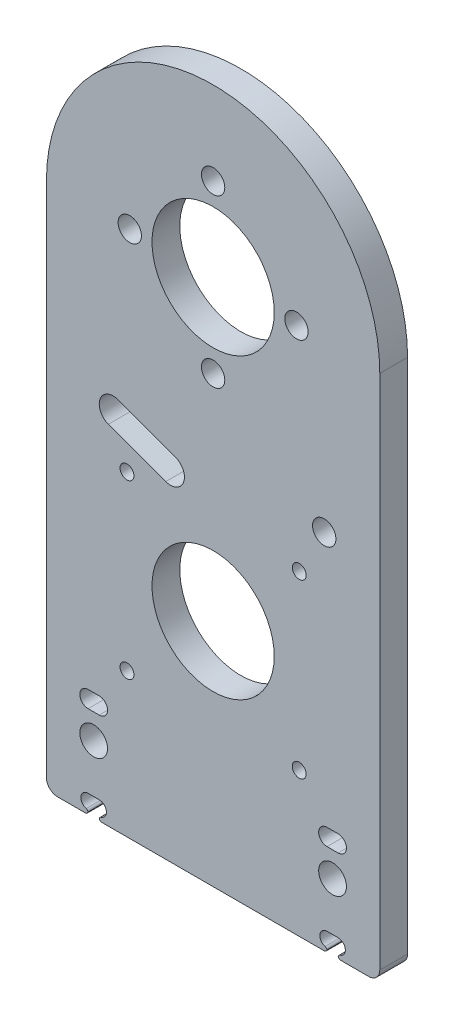
from build123d import *

# Parameters (mm, degrees)
SKETCH1_R           = 11
SKETCH1_R_2         = 1.25
SKETCH1_R_3         = 2.5
SKETCH1_R_4         = 2.1
BOSS_EXTRUDE1_DEPTH = 2.5
FILLET1_R           = 0.5
FILLET2_R           = 2


with BuildPart() as part:
    # Sketch1 → Boss-Extrude1 (new, symmetric)
    with BuildSketch(Plane.XY):
        with BuildLine():
            Line((-30, -46), (-22.5, -46))
            Line((-22.5, -46), (-22.5, -45.3))
            ThreePointArc((-22.5, -45.3), (-23.8, -44), (-22.5, -42.7))
            Line((-22.5, -42.7), (-20.5, -42.7))
            ThreePointArc((-20.5, -42.7), (-19.2, -44), (-20.5, -45.3))
            Line((-20.5, -45.3), (-20.5, -46))
            Line((-20.5, -46), (20.5, -46))
            Line((20.5, -46), (20.5, -45.3))
            ThreePointArc((20.5, -45.3), (19.2, -44), (20.5, -42.7))
            Line((20.5, -42.7), (22.5, -42.7))
            ThreePointArc((22.5, -42.7), (23.8, -44), (22.5, -45.3))
            Line((22.5, -45.3), (22.5, -46))
            Line((22.5, -46), (30, -46))
            Line((30, -46), (30, 49))
            ThreePointArc((30, 49), (0, 79), (-30, 49))
            Line((-30, 49), (-30, -46))
        make_face()
        with Locations((0, -4.6)):
            Circle(SKETCH1_R, mode=Mode.SUBTRACT)
        with Locations((15.5, 10.9)):
            Circle(SKETCH1_R_2, mode=Mode.SUBTRACT)
        with Locations((15.5, -20.1)):
            Circle(SKETCH1_R_2, mode=Mode.SUBTRACT)
        with Locations((-15.5, -20.1)):
            Circle(SKETCH1_R_2, mode=Mode.SUBTRACT)
        with Locations((-15.5, 10.9)):
            Circle(SKETCH1_R_2, mode=Mode.SUBTRACT)
        with Locations((0, 49)):
            Circle(SKETCH1_R, mode=Mode.SUBTRACT)
        with Locations((21.5, -34)):
            Circle(SKETCH1_R_3, mode=Mode.SUBTRACT)
        with Locations((-21.5, -34)):
            Circle(SKETCH1_R_3, mode=Mode.SUBTRACT)
        with Locations((0, 64)):
            Circle(SKETCH1_R_4, mode=Mode.SUBTRACT)
        with Locations((-15, 49)):
            Circle(SKETCH1_R_4, mode=Mode.SUBTRACT)
        with Locations((0, 34)):
            Circle(SKETCH1_R_4, mode=Mode.SUBTRACT)
        with Locations((15, 49)):
            Circle(SKETCH1_R_4, mode=Mode.SUBTRACT)
        with Locations((20, 19.25)):
            Circle(SKETCH1_R_4, mode=Mode.SUBTRACT)
        with BuildLine():
            Line((20.5, -26.5), (22.5, -26.5))
            ThreePointArc((22.5, -26.5), (24, -28), (22.5, -29.5))
            Line((22.5, -29.5), (20.5, -29.5))
            ThreePointArc((20.5, -29.5), (19, -28), (20.5, -26.5))
        make_face(mode=Mode.SUBTRACT)
        with BuildLine():
            Line((-20.5, -26.5), (-22.5, -26.5))
            ThreePointArc((-22.5, -26.5), (-24, -28), (-22.5, -29.5))
            Line((-22.5, -29.5), (-20.5, -29.5))
            ThreePointArc((-20.5, -29.5), (-19, -28), (-20.5, -26.5))
        make_face(mode=Mode.SUBTRACT)
        with BuildLine():
            Line((-8.51843153, 12.888546871), (-18.855050358, 16.650768448))
            ThreePointArc((-18.855050358, 16.650768448), (-20.349231552, 19.855050358), (-17.144949642, 21.349231552))
            Line((-17.144949642, 21.349231552), (-6.808330813, 17.587009975))
            ThreePointArc((-6.808330813, 17.587009975), (-5.314149619, 14.382728065), (-8.51843153, 12.888546871))
        make_face(mode=Mode.SUBTRACT)
    extrude(amount=BOSS_EXTRUDE1_DEPTH, both=True)

    # Fillet1
    # the kernel refuses this fillet: 0.5 mm, written as the material it takes off along each edge
    with BuildSketch(Plane(origin=(-22.5, -46, -3.75), x_dir=(0, 1, 0), z_dir=(0, 0, 1)), Plane(origin=(-20.5, -46, -3.75), x_dir=(1, 0, 0), z_dir=(0, 0, 1)), Plane(origin=(20.5, -46, -3.75), x_dir=(0, 1, 0), z_dir=(0, 0, 1)), Plane(origin=(22.5, -46, -3.75), x_dir=(1, 0, 0), z_dir=(0, 0, 1))) as fillet1_piece_1:
        with BuildLine():
            CenterArc((FILLET1_R, FILLET1_R), FILLET1_R, 180, 90)
            Line((0, FILLET1_R), (0, 0))
            Line((0, 0), (FILLET1_R, 0))
        make_face()
    extrude(amount=7.5, mode=Mode.SUBTRACT)
    with BuildSketch(Plane(origin=(-22.5, -45.3, -3.572904116), x_dir=(-0.990112458059838, 0.14027587246103826, 0), z_dir=(0, 0, 1))) as fillet1_piece_2:
        with BuildLine():
            CenterArc((0.434855205, 0.495056229), FILLET1_R, 188.063810107, 73.872379787)
            Line((-0.060201024, 0.424918293), (0, 0))
            ThreePointArc((0, 0), (0.182358634, 0.012853805), (0.364717268, 0))
        make_face()
    extrude(amount=7.145808233, mode=Mode.SUBTRACT)
    with BuildSketch(Plane(origin=(-20.5, -45.3, -3.572904116), x_dir=(0, -1, 0), z_dir=(0, 0, 1))) as fillet1_piece_3:
        with BuildLine():
            CenterArc((0.429161647, 0.5), FILLET1_R, 196.127620213, 73.872379787)
            ThreePointArc((-0.051161033, 0.361111111), (-0.012853805, 0.182358634), (0, 0))
            Line((0, 0), (0.429161647, 0))
        make_face()
    extrude(amount=7.145808233, mode=Mode.SUBTRACT)
    with BuildSketch(Plane(origin=(20.5, -45.3, 3.572904116), x_dir=(-0.9901124580598404, 0.14027587246102047, 0), z_dir=(0, 0, -1)), Plane(origin=(22.5, -45.3, -3.572904116), x_dir=(0.9901124580598378, 0.1402758724610396, 0), z_dir=(0, 0, 1))) as fillet1_piece_4:
        with BuildLine():
            CenterArc((0.434855205, -0.495056229), FILLET1_R, 98.063810107, 73.872379787)
            Line((-0.060201024, -0.424918293), (0, 0))
            ThreePointArc((0, 0), (0.182358634, -0.012853805), (0.364717268, 0))
        make_face()
    extrude(amount=7.145808233, mode=Mode.SUBTRACT)

    # Fillet2
    fillet2_edges = [part.edges().sort_by_distance(p)[0] for p in [
        (30, -46, 0),
        (-30, -46, 0),
    ]]
    fillet(fillet2_edges, radius=FILLET2_R)


solid = part.part
